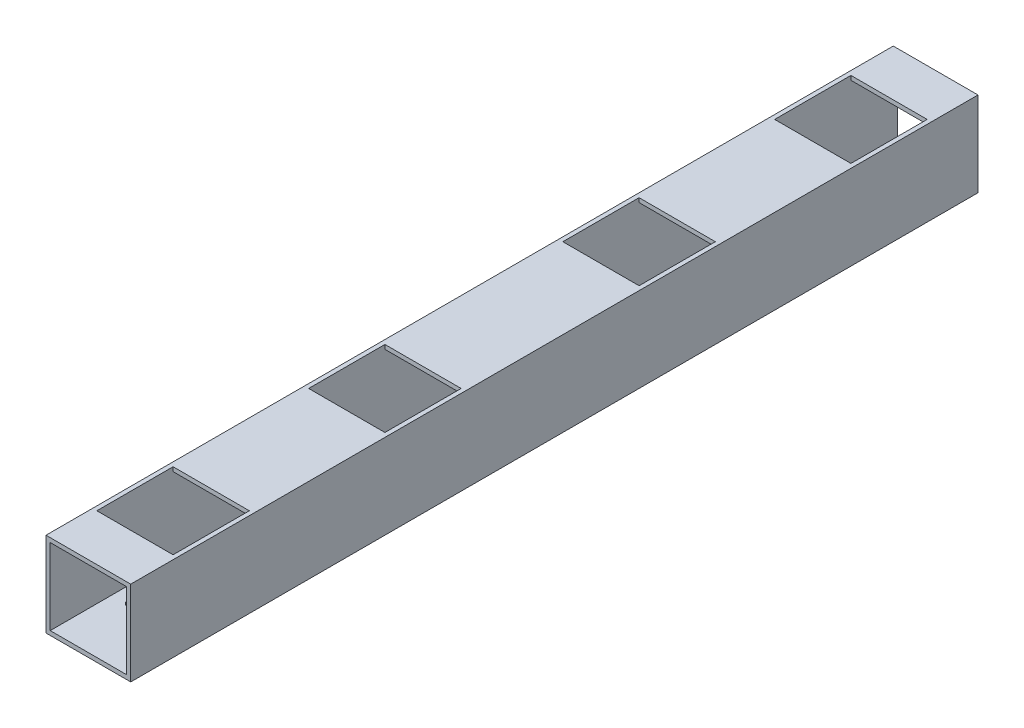
from build123d import *

# Parameters (mm, degrees)
SKETCH_1_W          = 20
SKETCH_1_H          = 20
SKETCH_1_W_2        = 18
SKETCH_1_H_2        = 18
EXTRUDE_1_DEPTH     = 200
SKETCH_3_R          = 1.6
CUT_EXTRUDE_1_DEPTH = 202.246117975
CUT_EXTRUDE_2_REACH = 203.246
SKETCH_4_W          = 18
SKETCH_4_H          = 18


with BuildPart() as part:
    # 草图1 → 凸台-拉伸1 (new body)
    with BuildSketch(Plane.XY):
        Rectangle(SKETCH_1_W, SKETCH_1_H)
        Rectangle(SKETCH_1_W_2, SKETCH_1_H_2, mode=Mode.SUBTRACT)
    extrude(amount=EXTRUDE_1_DEPTH)

    # 草图3 → 切除-拉伸1 (cut, through all)
    with BuildSketch(Plane(origin=(0, 10, 0), x_dir=(1, 0, 0), z_dir=(0, 1, 0))):
        with Locations((-4.5, -134.5)):
            Circle(SKETCH_3_R)
        with Locations((4.5, -134.5)):
            Circle(SKETCH_3_R)
        with Locations((4.5, -125.5)):
            Circle(SKETCH_3_R)
        with Locations((-4.5, -125.5)):
            Circle(SKETCH_3_R)
        with Locations((4.5, -65.5)):
            Circle(SKETCH_3_R)
        with Locations((4.5, -74.5)):
            Circle(SKETCH_3_R)
        with Locations((-4.5, -74.5)):
            Circle(SKETCH_3_R)
        with Locations((-4.5, -65.5)):
            Circle(SKETCH_3_R)
        with Locations((-4.5, -184.5)):
            Circle(SKETCH_3_R)
        with Locations((4.5, -184.5)):
            Circle(SKETCH_3_R)
        with Locations((4.5, -175.5)):
            Circle(SKETCH_3_R)
        with Locations((-4.5, -175.5)):
            Circle(SKETCH_3_R)
        with Locations((-4.5, -24.5)):
            Circle(SKETCH_3_R)
        with Locations((4.5, -24.5)):
            Circle(SKETCH_3_R)
        with Locations((4.5, -15.5)):
            Circle(SKETCH_3_R)
        with Locations((-4.5, -15.5)):
            Circle(SKETCH_3_R)
    extrude(amount=-CUT_EXTRUDE_1_DEPTH, mode=Mode.SUBTRACT)

    # 草图4 → 切除-拉伸2 (cut, up to next)
    with BuildSketch(Plane(origin=(0, 10, 0), x_dir=(1, 0, 0), z_dir=(0, 1, 0)), mode=Mode.PRIVATE) as cut_extrude_2_sk1:
        with Locations((0, -130)):
            Rectangle(SKETCH_4_W, SKETCH_4_H)
    cut_extrude_2_tool1 = extrude(cut_extrude_2_sk1.sketch, amount=-CUT_EXTRUDE_2_REACH, mode=Mode.PRIVATE) & part.part
    # 草图4 → 切除-拉伸2 (cut, up to next)
    with BuildSketch(Plane(origin=(0, 10, 0), x_dir=(1, 0, 0), z_dir=(0, 1, 0)), mode=Mode.PRIVATE) as cut_extrude_2_sk2:
        with Locations((0, -70)):
            Rectangle(SKETCH_4_W, SKETCH_4_H)
    cut_extrude_2_tool2 = extrude(cut_extrude_2_sk2.sketch, amount=-CUT_EXTRUDE_2_REACH, mode=Mode.PRIVATE) & part.part
    # 草图4 → 切除-拉伸2 (cut, up to next)
    with BuildSketch(Plane(origin=(0, 10, 0), x_dir=(1, 0, 0), z_dir=(0, 1, 0)), mode=Mode.PRIVATE) as cut_extrude_2_sk3:
        with Locations((0, -20)):
            Rectangle(SKETCH_4_W, SKETCH_4_H)
    cut_extrude_2_tool3 = extrude(cut_extrude_2_sk3.sketch, amount=-CUT_EXTRUDE_2_REACH, mode=Mode.PRIVATE) & part.part
    # 草图4 → 切除-拉伸2 (cut, up to next)
    with BuildSketch(Plane(origin=(0, 10, 0), x_dir=(1, 0, 0), z_dir=(0, 1, 0)), mode=Mode.PRIVATE) as cut_extrude_2_sk4:
        with Locations((0, -180)):
            Rectangle(SKETCH_4_W, SKETCH_4_H)
    cut_extrude_2_tool4 = extrude(cut_extrude_2_sk4.sketch, amount=-CUT_EXTRUDE_2_REACH, mode=Mode.PRIVATE) & part.part
    add(cut_extrude_2_tool1.solids().sort_by_distance((0, 10, 130))[0], mode=Mode.SUBTRACT)
    add(cut_extrude_2_tool2.solids().sort_by_distance((0, 10, 70))[0], mode=Mode.SUBTRACT)
    add(cut_extrude_2_tool3.solids().sort_by_distance((0, 10, 20))[0], mode=Mode.SUBTRACT)
    add(cut_extrude_2_tool4.solids().sort_by_distance((0, 10, 180))[0], mode=Mode.SUBTRACT)


solid = part.part
